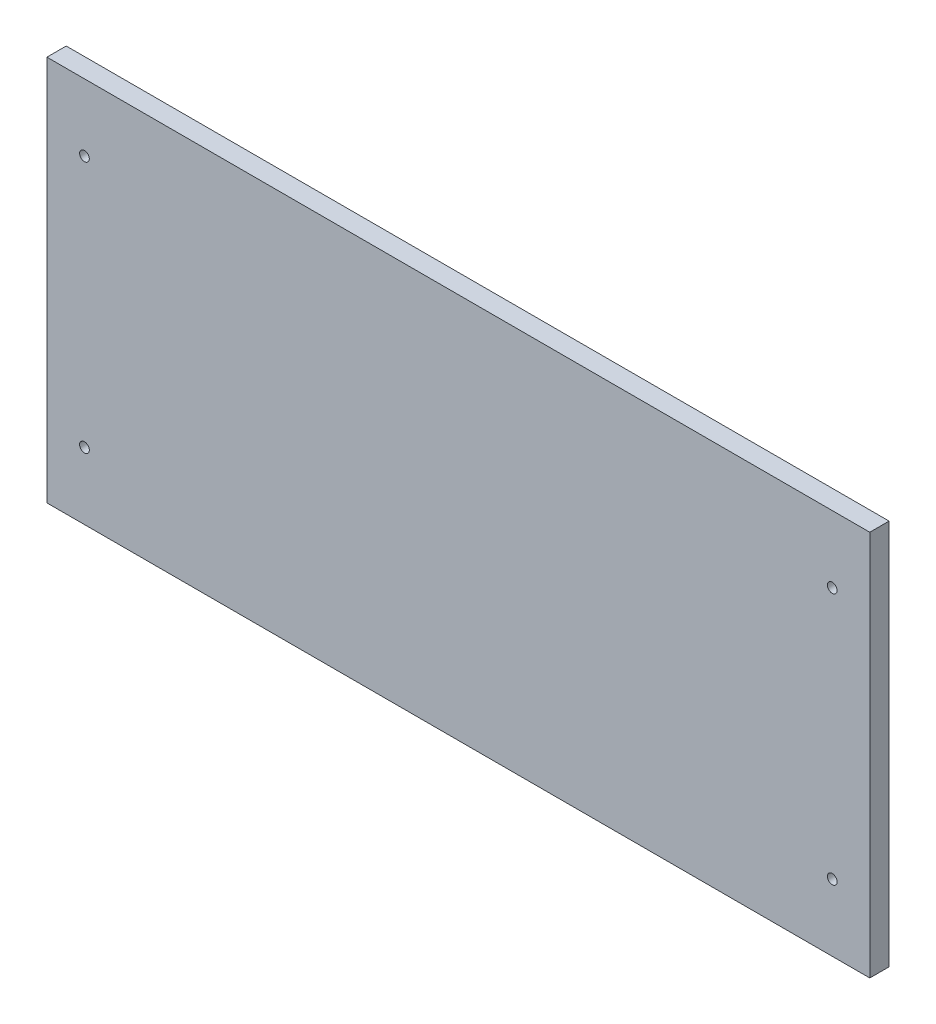
from build123d import *

# Parameters (mm, degrees)
SKETCH1_W  = 270.7
SKETCH1_H  = 127
SKETCH1_R  = 1.6
WALL_DEPTH = 6.35


with BuildPart() as part:
    # Sketch1 → Wall (new body)
    with BuildSketch(Plane.XY):
        with Locations((135.35, 63.5)):
            Rectangle(SKETCH1_W, SKETCH1_H)
        with Locations((12.35, 105)):
            Circle(SKETCH1_R, mode=Mode.SUBTRACT)
        with Locations((258.35, 105)):
            Circle(SKETCH1_R, mode=Mode.SUBTRACT)
        with Locations((258.35, 22)):
            Circle(SKETCH1_R, mode=Mode.SUBTRACT)
        with Locations((12.35, 22)):
            Circle(SKETCH1_R, mode=Mode.SUBTRACT)
    extrude(amount=WALL_DEPTH)


solid = part.part
